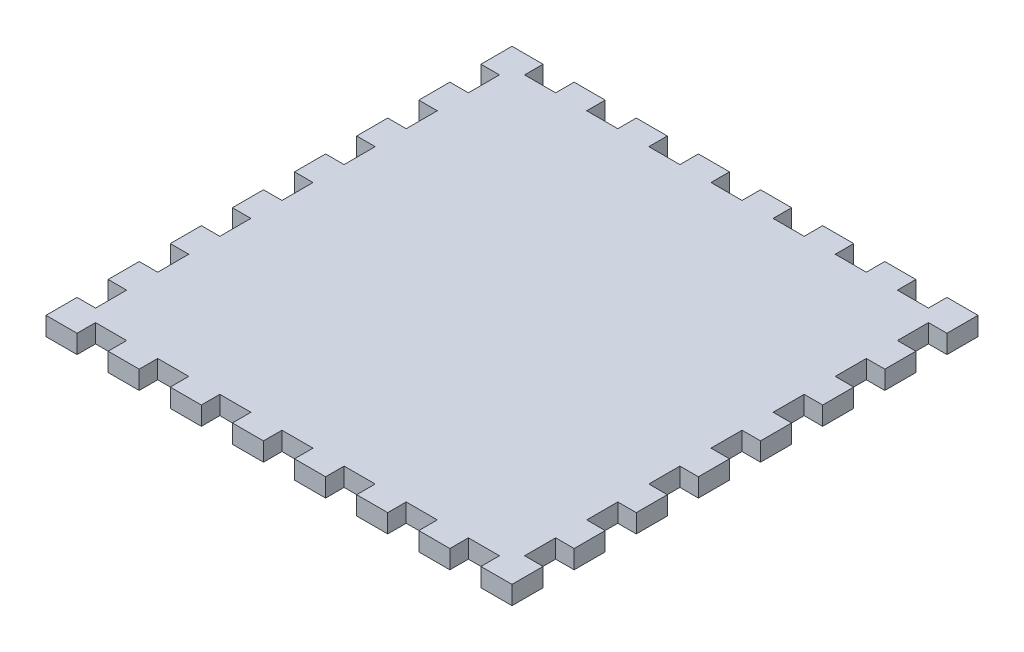
from build123d import *

# Parameters (mm, degrees)
SKETCH1_W           = 80
SKETCH1_H           = 80
BOSS_EXTRUDE1_DEPTH = 3.175
SKETCH2_OUTSIDE_W   = 104.636
SKETCH2_OUTSIDE_H   = 104.636
CUT_EXTRUDE3_DEPTH  = 57.657573413


with BuildPart() as part:
    # Sketch1 → Boss-Extrude1 (new body)
    with BuildSketch(Plane(origin=(0, 0, 0), x_dir=(1, 0, 0), z_dir=(0, 1, 0))):
        Rectangle(SKETCH1_W, SKETCH1_H)
    extrude(amount=BOSS_EXTRUDE1_DEPTH)

    # Sketch2 outside → Cut-Extrude3 (cut, through all)
    with BuildSketch(Plane(origin=(0, 3.175, 0), x_dir=(1, 0, 0), z_dir=(0, 1, 0))):
        Rectangle(SKETCH2_OUTSIDE_W, SKETCH2_OUTSIDE_H)
        Polygon((-40, -40), (-34.666666667, -40), (-34.666666667, -36.825), (-29.333333333, -36.825), (-29.333333333, -40), (-24, -40), (-24, -36.825), (-18.666666667, -36.825), (-18.666666667, -40), (-13.333333333, -40), (-13.333333333, -36.825), (-8, -36.825), (-8, -40), (-2.666666667, -40), (-2.666666667, -36.825), (2.666666667, -36.825), (2.666666667, -40), (8, -40), (8, -36.825), (13.333333333, -36.825), (13.333333333, -40), (18.666666667, -40), (18.666666667, -36.825), (24, -36.825), (24, -40), (29.333333333, -40), (29.333333333, -36.825), (34.666666667, -36.825), (34.666666667, -40), (40, -40), (40, -34.666666667), (36.825, -34.666666667), (36.825, -29.333333333), (40, -29.333333333), (40, -24), (36.825, -24), (36.825, -18.666666667), (40, -18.666666667), (40, -13.333333333), (36.825, -13.333333333), (36.825, -8), (40, -8), (40, -2.666666667), (36.825, -2.666666667), (36.825, 2.666666667), (40, 2.666666667), (40, 8), (36.825, 8), (36.825, 13.333333333), (40, 13.333333333), (40, 18.666666667), (36.825, 18.666666667), (36.825, 24), (40, 24), (40, 29.333333333), (36.825, 29.333333333), (36.825, 34.666666667), (40, 34.666666667), (40, 40), (34.666666667, 40), (34.666666667, 36.825), (29.333333333, 36.825), (29.333333333, 40), (24, 40), (24, 36.825), (18.666666667, 36.825), (18.666666667, 40), (13.333333333, 40), (13.333333333, 36.825), (8, 36.825), (8, 40), (2.666666667, 40), (2.666666667, 36.825), (-2.666666667, 36.825), (-2.666666667, 40), (-8, 40), (-8, 36.825), (-13.333333333, 36.825), (-13.333333333, 40), (-18.666666667, 40), (-18.666666667, 36.825), (-24, 36.825), (-24, 40), (-29.333333333, 40), (-29.333333333, 36.825), (-34.666666667, 36.825), (-34.666666667, 40), (-40, 40), (-40, 34.666666667), (-36.825, 34.666666667), (-36.825, 29.333333333), (-40, 29.333333333), (-40, 24), (-36.825, 24), (-36.825, 18.666666667), (-40, 18.666666667), (-40, 13.333333333), (-36.825, 13.333333333), (-36.825, 8), (-40, 8), (-40, 2.666666667), (-36.825, 2.666666667), (-36.825, -2.666666667), (-40, -2.666666667), (-40, -8), (-36.825, -8), (-36.825, -13.333333333), (-40, -13.333333333), (-40, -18.666666667), (-36.825, -18.666666667), (-36.825, -24), (-40, -24), (-40, -29.333333333), (-36.825, -29.333333333), (-36.825, -34.666666667), (-40, -34.666666667), align=None, mode=Mode.SUBTRACT)
    extrude(amount=-CUT_EXTRUDE3_DEPTH, mode=Mode.SUBTRACT)


solid = part.part
